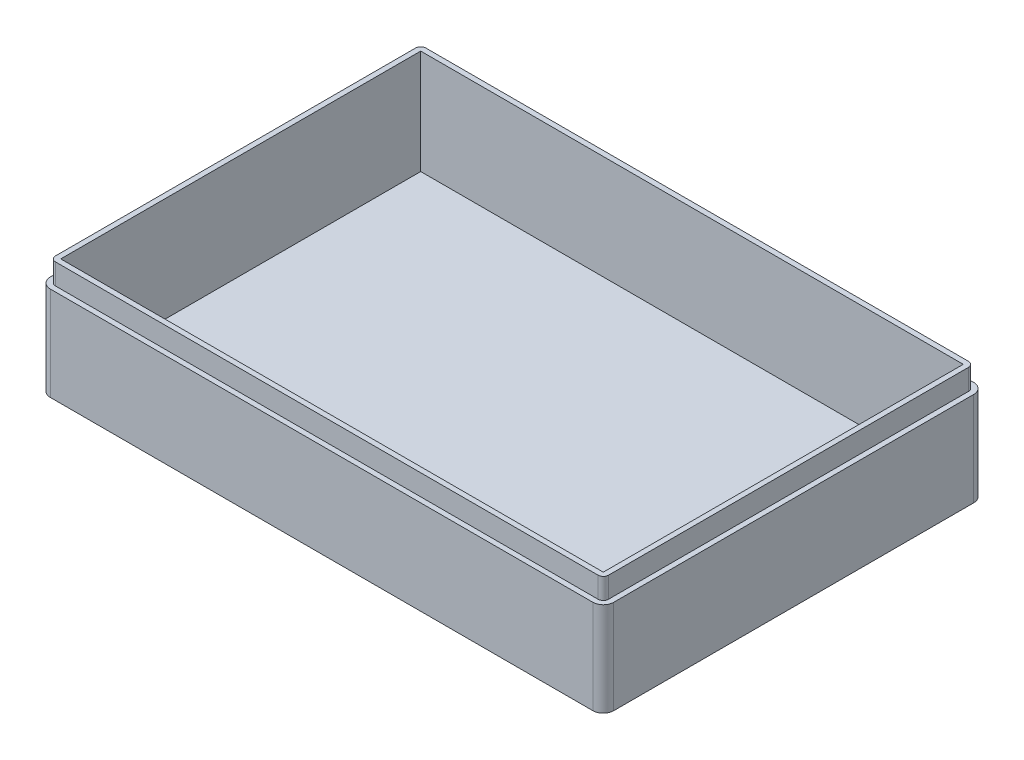
from build123d import *

# Parameters (mm, degrees)
SKETCH1_W           = 108
SKETCH1_H           = 73
BOSS_EXTRUDE1_DEPTH = 22
FILLET1_R           = 2
SHELL1_START        = -52
SHELL1_OUTLINE_W    = 20
SHELL1_OUTLINE_H    = 69
SHELL1_DEPTH        = 104
SKETCH6_OUTSIDE_W   = 136.44
SKETCH6_OUTSIDE_H   = 101.44
CUT_EXTRUDE5_DEPTH  = 4


# Read off the part's stored shape, not the designer's step: Shell1
with BuildPart() as part:
    # Sketch1 → Boss-Extrude1 (new body)
    with BuildSketch(Plane(origin=(0, 0, 0), x_dir=(1, 0, 0), z_dir=(0, 1, 0))):
        Rectangle(SKETCH1_W, SKETCH1_H)
    extrude(amount=BOSS_EXTRUDE1_DEPTH)

    # Fillet1
    fillet1_edges = [part.edges().sort_by_distance(p)[0] for p in [
        (54, 11, 36.5),
        (-54, 11, 36.5),
        (-54, 11, -36.5),
        (54, 11, -36.5),
    ]]
    fillet(fillet1_edges, radius=FILLET1_R)

    # Shell1 outline → Shell1 (cut)
    with BuildSketch(Plane.YZ.offset(SHELL1_START)):
        with Locations((12, 0)):
            Rectangle(SHELL1_OUTLINE_W, SHELL1_OUTLINE_H)
    extrude(amount=SHELL1_DEPTH, mode=Mode.SUBTRACT)

    # Sketch6 outside → Cut-Extrude5 (cut)
    with BuildSketch(Plane(origin=(0, 22, 0), x_dir=(1, 0, 0), z_dir=(0, 1, 0))):
        Rectangle(SKETCH6_OUTSIDE_W, SKETCH6_OUTSIDE_H)
        with BuildLine():
            Line((53, -34.5), (53, 34.5))
            ThreePointArc((53, 34.5), (52.707106781, 35.207106781), (52, 35.5))
            Line((52, 35.5), (-52, 35.5))
            ThreePointArc((-52, 35.5), (-52.707106781, 35.207106781), (-53, 34.5))
            Line((-53, 34.5), (-53, -34.5))
            ThreePointArc((-53, -34.5), (-52.707106781, -35.207106781), (-52, -35.5))
            Line((-52, -35.5), (52, -35.5))
            ThreePointArc((52, -35.5), (52.707106781, -35.207106781), (53, -34.5))
        make_face(mode=Mode.SUBTRACT)
    extrude(amount=-CUT_EXTRUDE5_DEPTH, mode=Mode.SUBTRACT)


solid = part.part
